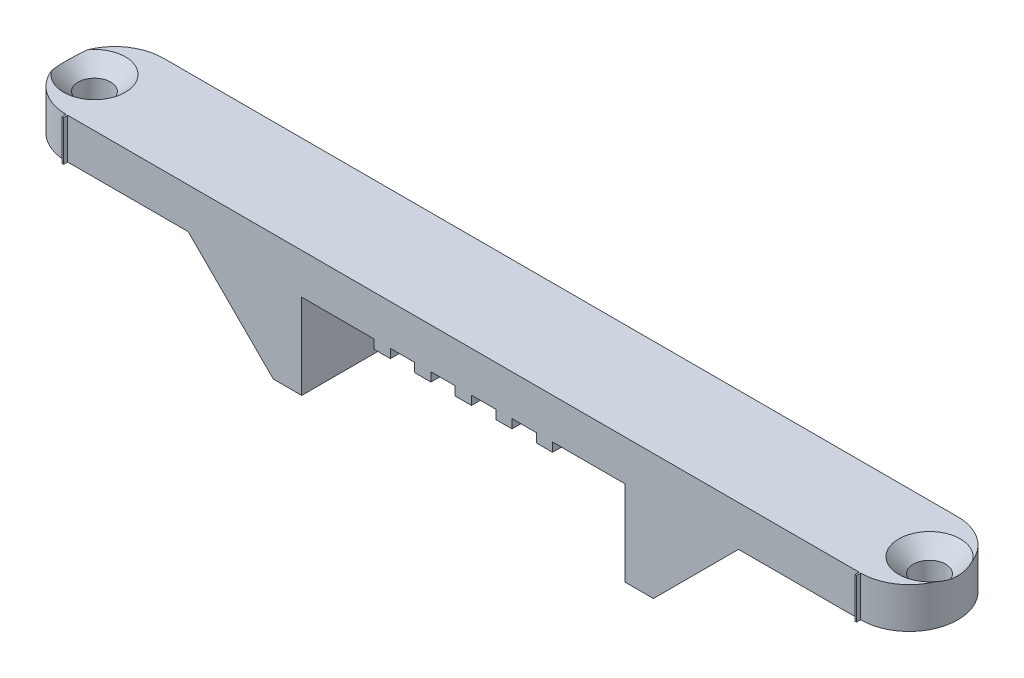
from build123d import *

# Parameters (mm, degrees)
SKETCH1_R                     = 1.5
BOSS_EXTRUDE1_DEPTH           = 3
SKETCH4_W                     = 3.5
SKETCH4_H                     = 12
BOSS_EXTRUDE3_DEPTH           = 10.5
SKETCH5_W                     = 2
SKETCH5_H                     = 12
BOSS_EXTRUDE4_DEPTH           = 1.1
SKETCH6_W                     = 0.2
SKETCH6_H                     = 3
BOSS_EXTRUDE5_DEPTH           = 0.5
CHAMFER1_SIZE                 = 10.5
SKETCH10_R                    = 1.5
BOSS_EXTRUDE6_DEPTH           = 2
CSK_FOR_M4_SFHCS1_D           = 4
CSK_FOR_M4_SFHCS1_DEPTH       = 30.798278762
CSK_FOR_M4_SFHCS1_CSINK_D     = 7.6
CSK_FOR_M4_SFHCS1_CSINK_ANGLE = 90
CSK_FOR_M4_SFHCS1_TIP         = 1.201721238


with BuildPart() as part:
    # Sketch1 → Boss-Extrude1 (new body)
    with BuildSketch(Plane(origin=(0, 0, 0), x_dir=(1, 0, 0), z_dir=(0, 1, 0))):
        with BuildLine():
            Line((-49, 6), (49, 6))
            ThreePointArc((49, 6), (55, 0), (49, -6))
            Line((49, -6), (-49, -6))
            ThreePointArc((-49, -6), (-55, 0), (-49, 6))
        make_face()
        with Locations(Location((-51.5, 0, 0), (0, 0, 270))):
            Circle(SKETCH1_R, mode=Mode.SUBTRACT)
        with Locations(Location((51.5, 0, 0), (0, 0, 270))):
            Circle(SKETCH1_R, mode=Mode.SUBTRACT)
    extrude(amount=BOSS_EXTRUDE1_DEPTH)

    # Sketch4 → Boss-Extrude3 (add)
    with BuildSketch(Plane.XZ):
        with Locations((-21.690023983, 0)):
            Rectangle(SKETCH4_W, SKETCH4_H)
        with Locations((21.690023983, 0)):
            Rectangle(SKETCH4_W, SKETCH4_H)
    extrude(amount=BOSS_EXTRUDE3_DEPTH)

    # Sketch5 → Boss-Extrude4 (add)
    with BuildSketch(Plane.XZ):
        with Locations((5, 0)):
            Rectangle(SKETCH5_W, SKETCH5_H)
        Rectangle(SKETCH5_W, SKETCH5_H)
        with Locations((10, 0)):
            Rectangle(SKETCH5_W, SKETCH5_H)
        with Locations((-5, 0)):
            Rectangle(SKETCH5_W, SKETCH5_H)
        with Locations((-10, 0)):
            Rectangle(SKETCH5_W, SKETCH5_H)
    extrude(amount=BOSS_EXTRUDE4_DEPTH)

    # Sketch6 → Boss-Extrude5 (add)
    with BuildSketch(Plane.XY.offset(6)):
        with Locations((48.9, 1.5)):
            Rectangle(SKETCH6_W, SKETCH6_H)
        with Locations((-48.9, 1.5)):
            Rectangle(SKETCH6_W, SKETCH6_H)
    extrude(amount=BOSS_EXTRUDE5_DEPTH)

    # Chamfer1
    chamfer1_edges = [part.edges().sort_by_distance(p)[0] for p in [
        (-23.440023983, 0, 0),
        (23.440023983, 0, 0),
    ]]
    chamfer(chamfer1_edges, length=CHAMFER1_SIZE - 0.0001)  # a hair under: the kernel refuses the full size

    # Sketch10 → Boss-Extrude6 (add)
    with BuildSketch(Plane(origin=(0, 3, 0), x_dir=(1, 0, 0), z_dir=(0, 1, 0))):
        with BuildLine():
            Line((-49, -6), (-49, -6.5))
            Line((-49, -6.5), (-48.8, -6.5))
            Line((-48.8, -6.5), (-48.8, -6))
            Line((-48.8, -6), (48.8, -6))
            Line((48.8, -6), (48.8, -6.5))
            Line((48.8, -6.5), (49, -6.5))
            Line((49, -6.5), (49, -6))
            ThreePointArc((49, -6), (55, 0), (49, 6))
            Line((49, 6), (-49, 6))
            ThreePointArc((-49, 6), (-55, 0), (-49, -6))
        make_face()
        with Locations(Location((-51.5, 0, 0), (0, 0, 270))):
            Circle(SKETCH10_R, mode=Mode.SUBTRACT)
        with Locations(Location((51.5, 0, 0), (0, 0, 270))):
            Circle(SKETCH10_R, mode=Mode.SUBTRACT)
    extrude(amount=BOSS_EXTRUDE6_DEPTH)

    # CSK for M4 SFHCS1
    with Locations(Plane(origin=(0, 5, 0), x_dir=(1, 0, 0), z_dir=(0, 1, 0))):
        with Locations((51.5, 0), (-51.5, 0)):
            CounterSinkHole(CSK_FOR_M4_SFHCS1_D / 2, CSK_FOR_M4_SFHCS1_CSINK_D / 2, depth=CSK_FOR_M4_SFHCS1_DEPTH, counter_sink_angle=CSK_FOR_M4_SFHCS1_CSINK_ANGLE)
            with Locations((0, 0, -(CSK_FOR_M4_SFHCS1_DEPTH + CSK_FOR_M4_SFHCS1_TIP / 2))):  # 118° drill point
                Cone(0, CSK_FOR_M4_SFHCS1_D / 2, CSK_FOR_M4_SFHCS1_TIP, mode=Mode.SUBTRACT)


solid = part.part
